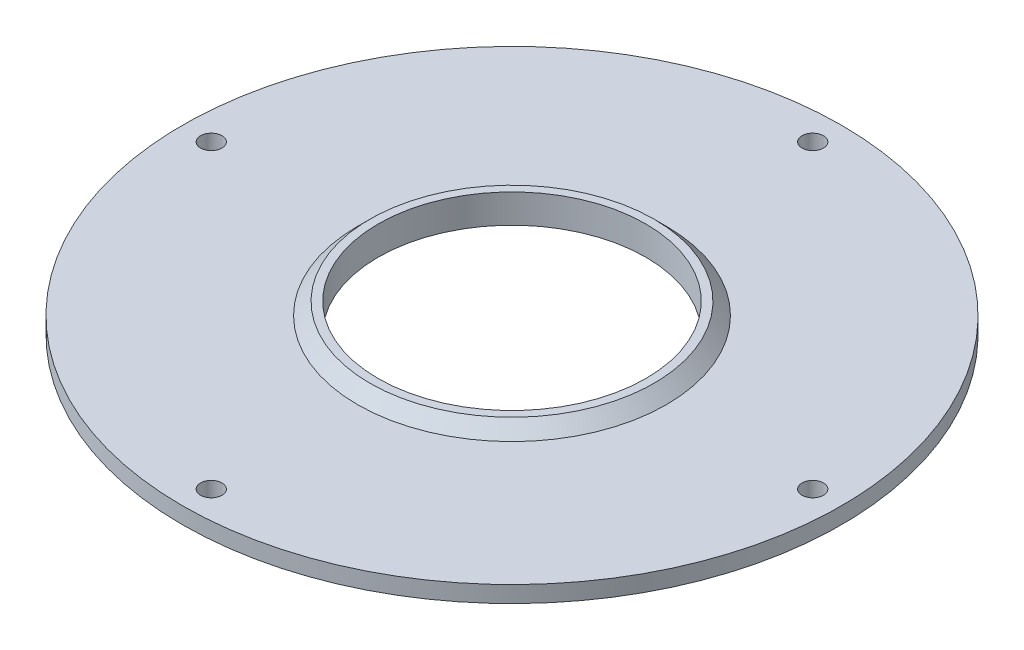
from build123d import *

# Parameters (mm, degrees)
SKETCH1_R           = 80
SKETCH1_R_2         = 32.5
BOSS_EXTRUDE1_DEPTH = 4
SKETCH2_R           = 2.6
CUT_EXTRUDE1_DEPTH  = 114.207773585
SKETCH3_R           = 34.5
SKETCH3_R_2         = 32.5
BOSS_EXTRUDE2_DEPTH = 3
CHAMFER1_SIZE       = 3


with BuildPart() as part:
    # Sketch1 → Boss-Extrude1 (new body)
    with BuildSketch(Plane(origin=(0, 0, 0), x_dir=(1, 0, 0), z_dir=(0, 1, 0))):
        with Locations(Location((0, 0, 0), (0, 0, 270))):
            Circle(SKETCH1_R)
        with Locations(Location((0, 0, 0), (0, 0, 270))):
            Circle(SKETCH1_R_2, mode=Mode.SUBTRACT)
    extrude(amount=BOSS_EXTRUDE1_DEPTH)

    # Sketch2 → Cut-Extrude1 (cut, through all)
    with BuildSketch(Plane(origin=(0, 4, 0), x_dir=(1, 0, 0), z_dir=(0, 1, 0))):
        with Locations(Location((0, 73, 0), (0, 0, 270))):
            Circle(SKETCH2_R)
        with Locations(Location((73, 0, 0), (0, 0, 270))):
            Circle(SKETCH2_R)
        with Locations(Location((0, -73, 0), (0, 0, 270))):
            Circle(SKETCH2_R)
        with Locations(Location((-73, 0, 0), (0, 0, 270))):
            Circle(SKETCH2_R)
    extrude(amount=-CUT_EXTRUDE1_DEPTH, mode=Mode.SUBTRACT)

    # Sketch3 → Boss-Extrude2 (add)
    with BuildSketch(Plane(origin=(0, 4, 0), x_dir=(1, 0, 0), z_dir=(0, 1, 0))):
        with Locations(Location((0, 0, 0), (0, 0, 270))):
            Circle(SKETCH3_R)
        with Locations(Location((0, 0, 0), (0, 0, 270))):
            Circle(SKETCH3_R_2, mode=Mode.SUBTRACT)
    extrude(amount=BOSS_EXTRUDE2_DEPTH)

    # Chamfer1
    chamfer1_edges = [part.edges().sort_by_distance(p)[0] for p in [
        (0, 4, -34.5),
    ]]
    chamfer(chamfer1_edges, length=CHAMFER1_SIZE - 0.0001)  # a hair under: the kernel refuses the full size


solid = part.part
